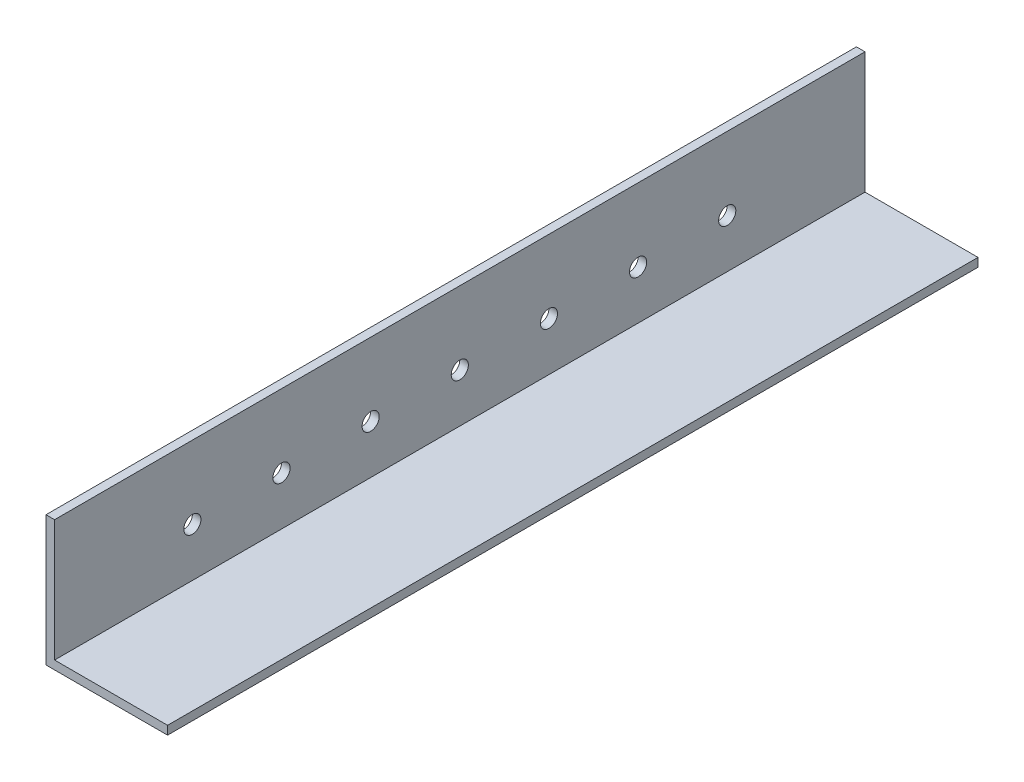
from build123d import *

# Parameters (mm, degrees)
SALIENTE_EXTRUIR1_DEPTH = 150
CROQUIS2_R              = 3.175
CORTAR_EXTRUIR1_DEPTH   = 50


with BuildPart() as part:
    # Croquis1 → Saliente-Extruir1 (new, symmetric)
    with BuildSketch(Plane.XY):
        Polygon((-22.5, -25.675), (22.5, -25.675), (22.5, -22.5), (-19.325, -22.5), (-19.325, 22.5), (-22.5, 22.5), align=None)
    extrude(amount=SALIENTE_EXTRUIR1_DEPTH, both=True)

    # Croquis2 → Cortar-Extruir1 (cut)
    with BuildSketch(Plane(origin=(0, 0, 0), x_dir=(0, 0, -1), z_dir=(1, 0, 0))):
        with Locations((0, -4.5)):
            Circle(CROQUIS2_R)
        with Locations((33, -4.5)):
            Circle(CROQUIS2_R)
        with Locations((66, -4.5)):
            Circle(CROQUIS2_R)
        with Locations((99, -4.5)):
            Circle(CROQUIS2_R)
        with Locations((-99, -4.5)):
            Circle(CROQUIS2_R)
        with Locations((-66, -4.5)):
            Circle(CROQUIS2_R)
        with Locations((-33, -4.5)):
            Circle(CROQUIS2_R)
    extrude(amount=-CORTAR_EXTRUIR1_DEPTH, mode=Mode.SUBTRACT)


solid = part.part
